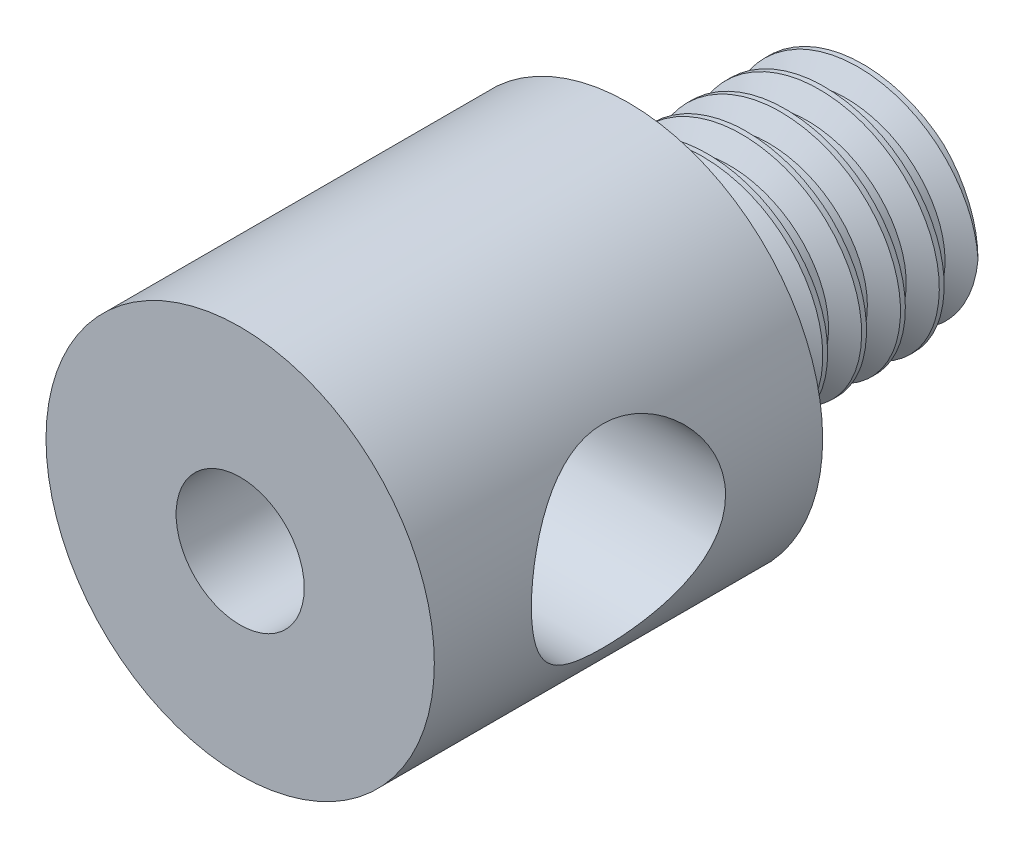
from build123d import *

# Parameters (mm, degrees)
SKETCH3_R                 = 5
BOSS_EXTRUDE2_DEPTH       = 10
SKETCH4_R                 = 2.5
CUT_EXTRUDE1_DEPTH        = 16.242297437
M4X0_7_TAPPED_HOLE1_D     = 3.3
M4X0_7_TAPPED_HOLE1_DEPTH = 5
M4X0_7_TAPPED_HOLE1_TIP   = 0.991420021
SKETCH8_R                 = 3
BOSS_EXTRUDE3_DEPTH       = 6
THREAD2_PITCH             = 1


with BuildPart() as part:
    # Sketch3 → Boss-Extrude2 (new body)
    with BuildSketch(Plane.XY):
        with Locations((-2.980817702, 0.685739279)):
            Circle(SKETCH3_R)
    extrude(amount=BOSS_EXTRUDE2_DEPTH)

    # Sketch4 → Cut-Extrude1 (cut, through all)
    with BuildSketch(Plane.ZY.offset(7.980817702)):
        with Locations((5, 0.685739279)):
            Circle(SKETCH4_R)
    extrude(amount=-CUT_EXTRUDE1_DEPTH, mode=Mode.SUBTRACT)

    # M4x0.7 Tapped Hole1
    with Locations(Plane.XY.offset(10)):
        with Locations((-2.980817702, 0.685739279)):
            Hole(M4X0_7_TAPPED_HOLE1_D / 2, depth=M4X0_7_TAPPED_HOLE1_DEPTH)
            with Locations((0, 0, -(M4X0_7_TAPPED_HOLE1_DEPTH + M4X0_7_TAPPED_HOLE1_TIP / 2))):  # 118° drill point
                Cone(0, M4X0_7_TAPPED_HOLE1_D / 2, M4X0_7_TAPPED_HOLE1_TIP, mode=Mode.SUBTRACT)

    # Sketch8 → Boss-Extrude3 (add)
    with BuildSketch(Plane(origin=(0, 0, 0), x_dir=(-1, 0, 0), z_dir=(0, 0, -1))):
        with Locations((2.980817702, 0.685739279)):
            Circle(SKETCH8_R)
    extrude(amount=BOSS_EXTRUDE3_DEPTH)

    # Thread2: the profile of Thread Profile2 profile screwed along a right-hand helix of 7 turns, 8 arcs to a turn; built about Z, then put on its axis
    thread2_z = Axis((0, 0, 0), (0, 0, 1))
    thread2_corners = [(3.0003, 0, -0.000173205), (3.0003, 0, 0.875173202), (2.458734125, 0, 0.562499999), (2.458734125, 0, 0.312499999)]
    with BuildLine(mode=Mode.PRIVATE) as thread2_profile:
        Line(thread2_corners[0], thread2_corners[1])
        Line(thread2_corners[1], thread2_corners[2])
        Line(thread2_corners[2], thread2_corners[3])
        Line(thread2_corners[3], thread2_corners[0])
    thread2_cap = Face(thread2_profile.wire())
    thread2_turn_angles = [0, 22.5, 45, 67.5, 90, 112.5, 135, 157.5, 180, 202.5, 225, 247.5, 270, 292.5, 315, 337.5, 360]
    thread2_turn_weights = [1, 0.9238795325112867, 1, 0.9238795325112867, 1, 0.9238795325112867, 1, 0.9238795325112867, 1, 0.9238795325112867, 1, 0.9238795325112867, 1, 0.9238795325112867, 1, 0.9238795325112867, 1]
    thread2_turn_rails = [Edge.make_bspline([Vector(p[0], p[1], 0).rotate(thread2_z, thread2_turn_angles[k]) / thread2_turn_weights[k] + Vector(0, 0, p[2] + THREAD2_PITCH * thread2_turn_angles[k] / 360) for k in range(17)], [0, 0, 0, 1, 1, 2, 2, 3, 3, 4, 4, 5, 5, 6, 6, 7, 7, 8, 8, 8], 2, thread2_turn_weights) for p in thread2_corners]
    thread2_turn_sides = [Face.make_surface_from_curves(thread2_turn_rails[p[0]], thread2_turn_rails[p[1]]) for p in [(0, 1), (1, 2), (2, 3), (3, 0)]]
    thread2 = Plane(origin=(-2.980817702, 0.685739279, -7), x_dir=(1, 0, 0), z_dir=(0, 0, 1)) * Solid(Shell([*[p.moved(Location((0, 0, THREAD2_PITCH * i))) for i in range(7) for p in thread2_turn_sides], thread2_cap, thread2_cap.rotate(thread2_z, 2520).moved(Location((0, 0, THREAD2_PITCH * 2520 / 360)))]))
    add(thread2, mode=Mode.SUBTRACT)


solid = part.part
